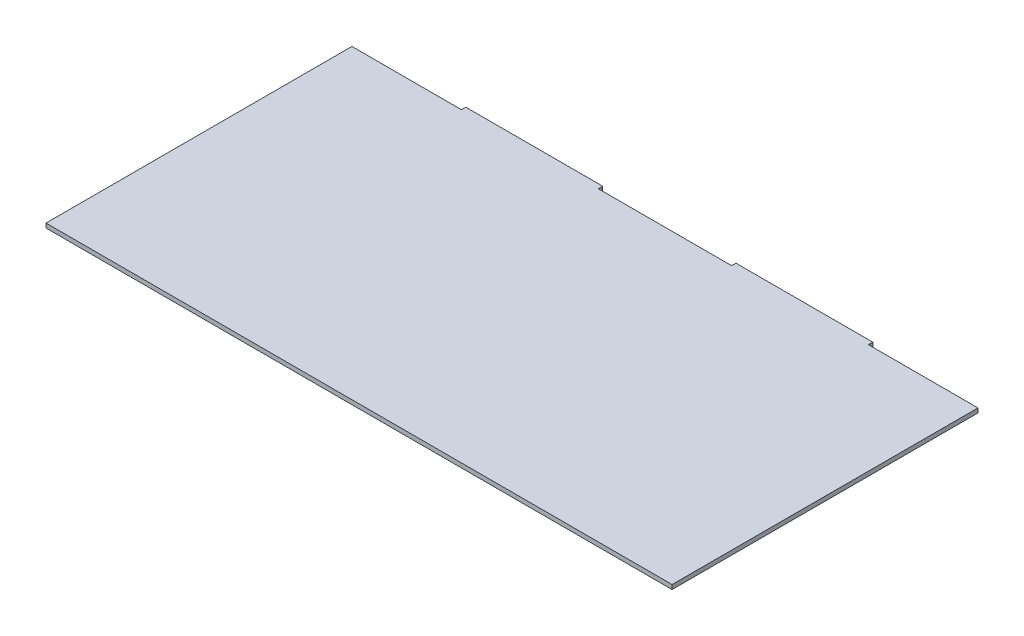
from build123d import *

# Parameters (mm, degrees)
SKETCH1_W           = 457.2
SKETCH1_H           = 3.175
BOSS_EXTRUDE1_DEPTH = 223.380000026
SKETCH2_W           = 100
SKETCH2_H           = 3.175
BOSS_EXTRUDE2_DEPTH = 3.175


with BuildPart() as part:
    # Sketch1 → Boss-Extrude1 (new body)
    with BuildSketch(Plane.XY):
        Rectangle(SKETCH1_W, SKETCH1_H)
    extrude(amount=BOSS_EXTRUDE1_DEPTH)

    # Sketch2 → Boss-Extrude2 (add)
    with BuildSketch(Plane(origin=(0, 0, 0), x_dir=(-1, 0, 0), z_dir=(0, 0, -1))):
        with Locations((-98.6115, 2e-08)):
            Rectangle(SKETCH2_W, SKETCH2_H)
        with Locations((98.6115, 2e-08)):
            Rectangle(SKETCH2_W, SKETCH2_H)
    extrude(amount=BOSS_EXTRUDE2_DEPTH)


solid = part.part
